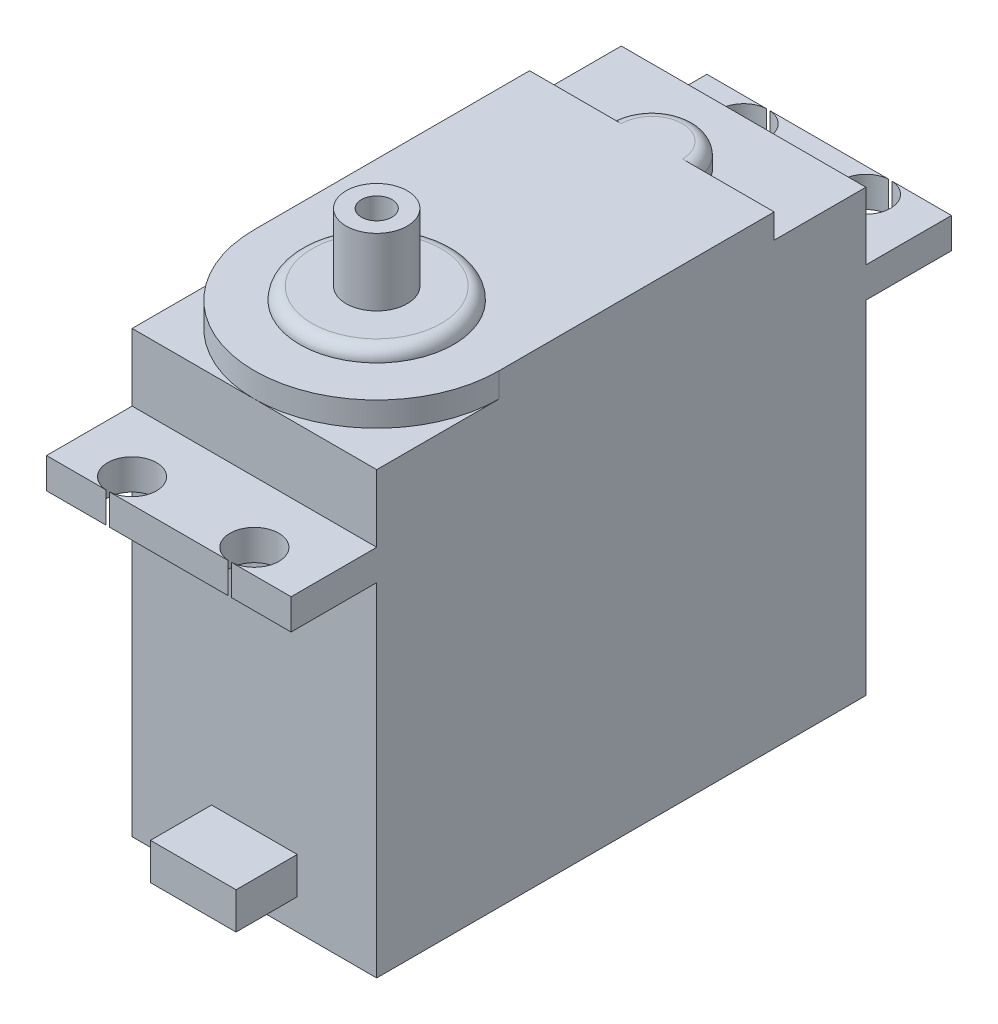
from build123d import *

# Parameters (mm, degrees)
SKETCH1_W                = 20
SKETCH1_H                = 40
BOSS_EXTRUDE1_DEPTH      = 36
SKETCH2_W                = 7
SKETCH2_H                = 3
BOSS_EXTRUDE2_DEPTH      = 5
SKETCH3_R                = 2.5
BOSS_EXTRUDE3_DEPTH      = 8.5
BOSS_EXTRUDE4_DEPTH      = 7
BOSS_EXTRUDE4_DEPTH_BACK = 47
SKETCH4_W                = 20
SKETCH4_H                = 2.5
SKETCH5_R                = 2
CUT_EXTRUDE1_DEPTH       = 7
BOSS_EXTRUDE5_DEPTH      = 2
SKETCH7_R                = 6.289454611
BOSS_EXTRUDE6_DEPTH      = 1
FILLET1_R                = 1
FILLET2_R                = 1
SKETCH8_R                = 1.25
CUT_EXTRUDE2_DEPTH       = 5


with BuildPart() as part:
    # Sketch1 → Boss-Extrude1 (new body)
    with BuildSketch(Plane(origin=(0, 0, 0), x_dir=(1, 0, 0), z_dir=(0, 1, 0))):
        with Locations((10, 20)):
            Rectangle(SKETCH1_W, SKETCH1_H)
    extrude(amount=BOSS_EXTRUDE1_DEPTH)

    # Sketch2 → Boss-Extrude2 (add)
    with BuildSketch(Plane.XY):
        with Locations((10, 4)):
            Rectangle(SKETCH2_W, SKETCH2_H)
    extrude(amount=BOSS_EXTRUDE2_DEPTH)

    # Sketch3 → Boss-Extrude3 (add)
    with BuildSketch(Plane(origin=(0, 36, 0), x_dir=(1, 0, 0), z_dir=(0, 1, 0))):
        with Locations(Location((10, 10, 0), (0, 0, 90))):
            Circle(SKETCH3_R)
    extrude(amount=BOSS_EXTRUDE3_DEPTH)

    # Sketch4 → Boss-Extrude4 (add, two sides: drawn at the far end of the back side and taken through both)
    with BuildSketch(Plane.XY.offset(-BOSS_EXTRUDE4_DEPTH_BACK)):
        with Locations((10, 29.25)):
            Rectangle(SKETCH4_W, SKETCH4_H)
    extrude(amount=BOSS_EXTRUDE4_DEPTH + BOSS_EXTRUDE4_DEPTH_BACK)

    # Sketch5 → Cut-Extrude1 (cut)
    with BuildSketch(Plane(origin=(0, 30.5, 0), x_dir=(1, 0, 0), z_dir=(0, 1, 0))):
        with Locations((15, 45.005)):
            Circle(SKETCH5_R)
        with Locations((5, 45.005)):
            Circle(SKETCH5_R)
        with Locations((15, -5.005)):
            Circle(SKETCH5_R)
        with Locations((5, -5.005)):
            Circle(SKETCH5_R)
    extrude(amount=-CUT_EXTRUDE1_DEPTH, mode=Mode.SUBTRACT)

    # Sketch6 → Boss-Extrude5 (add)
    with BuildSketch(Plane(origin=(0, 36, 0), x_dir=(1, 0, 0), z_dir=(0, 1, 0))):
        with BuildLine():
            Line((20, 32.5), (13.5, 32.5))
            ThreePointArc((13.5, 32.5), (10, 36), (6.5, 32.5))
            Line((6.5, 32.5), (0, 32.5))
            Line((0, 32.5), (0, 10))
            ThreePointArc((0, 10), (10, 0), (20, 10))
            Line((20, 10), (20, 32.5))
        make_face()
    extrude(amount=BOSS_EXTRUDE5_DEPTH)

    # Sketch7 → Boss-Extrude6 (add)
    with BuildSketch(Plane(origin=(0, 38, 0), x_dir=(1, 0, 0), z_dir=(0, 1, 0))):
        with Locations(Location((10, 10, 0), (0, 0, 270))):
            Circle(SKETCH7_R)
    extrude(amount=BOSS_EXTRUDE6_DEPTH)

    # Fillet1
    fillet1_edges = [part.edges().sort_by_distance(p)[0] for p in [
        (10, 39, -16.289454611),
    ]]
    fillet(fillet1_edges, radius=FILLET1_R - 0.0001)  # a hair under: the kernel refuses the full size

    # Fillet2
    fillet2_edges = [part.edges().sort_by_distance(p)[0] for p in [
        (10, 38, -36),
    ]]
    fillet(fillet2_edges, radius=FILLET2_R)

    # Sketch8 → Cut-Extrude2 (cut)
    with BuildSketch(Plane(origin=(0, 44.5, 0), x_dir=(1, 0, 0), z_dir=(0, 1, 0))):
        with Locations(Location((10, 10, 0), (0, 0, 270))):
            Circle(SKETCH8_R)
    extrude(amount=-CUT_EXTRUDE2_DEPTH, mode=Mode.SUBTRACT)


solid = part.part
